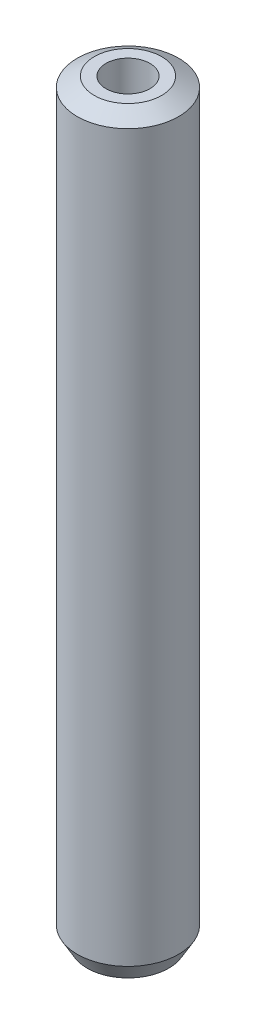
from build123d import *
from OCP.BRepFilletAPI import BRepFilletAPI_MakeChamfer

# Parameters (mm, degrees)
SKETCH1_R           = 5
BOSS_EXTRUDE1_DEPTH = 74.234313682
SKETCH2_R           = 2.168222718
CUT_EXTRUDE1_DEPTH  = 75.570324713
CHAMFER1_SIZE       = 0.967528718
CHAMFER1_SIZE2      = 1.675808898


with BuildPart() as part:
    # Sketch1 → Boss-Extrude1 (new body)
    with BuildSketch(Plane(origin=(0, 0, 0), x_dir=(1, 0, 0), z_dir=(0, 1, 0))):
        Circle(SKETCH1_R)
    extrude(amount=BOSS_EXTRUDE1_DEPTH)

    # Sketch2 → Cut-Extrude1 (cut, through all)
    with BuildSketch(Plane(origin=(0, 0, 0), x_dir=(1, 0, 0), z_dir=(0, 1, 0))):
        Circle(SKETCH2_R)
    extrude(amount=CUT_EXTRUDE1_DEPTH, mode=Mode.SUBTRACT)

    # Chamfer1: one chamfer whose edges measure the first distance from different faces: ONE call of the kernel's chamfer builder (chamfer() names one face for all edges)
    chamfer1_edges_1 = [part.edges().sort_by_distance(p)[0] for p in [
        (-5, 74.234313682, 0),
    ]]
    chamfer1_side_1 = [part.faces().sort_by_distance(p)[0] for p in [
        (-5, 37.117156841, 0),
    ]]
    chamfer1_edges_2 = [part.edges().sort_by_distance(p)[0] for p in [
        (-5, 0, 0),
    ]]
    chamfer1_side_2 = [part.faces().sort_by_distance(p)[0] for p in [
        (-4.858578644, 0, 0),
    ]]
    chamfer1 = BRepFilletAPI_MakeChamfer(part.part.solid().wrapped)
    for e in chamfer1_edges_1:
        chamfer1.Add(CHAMFER1_SIZE, CHAMFER1_SIZE2, e.wrapped, chamfer1_side_1[0].wrapped)  # the first distance lies on this face
    for e in chamfer1_edges_2:
        chamfer1.Add(CHAMFER1_SIZE, CHAMFER1_SIZE2, e.wrapped, chamfer1_side_2[0].wrapped)  # the first distance lies on this face
    add(Compound.cast(chamfer1.Shape()), mode=Mode.REPLACE)


solid = part.part
